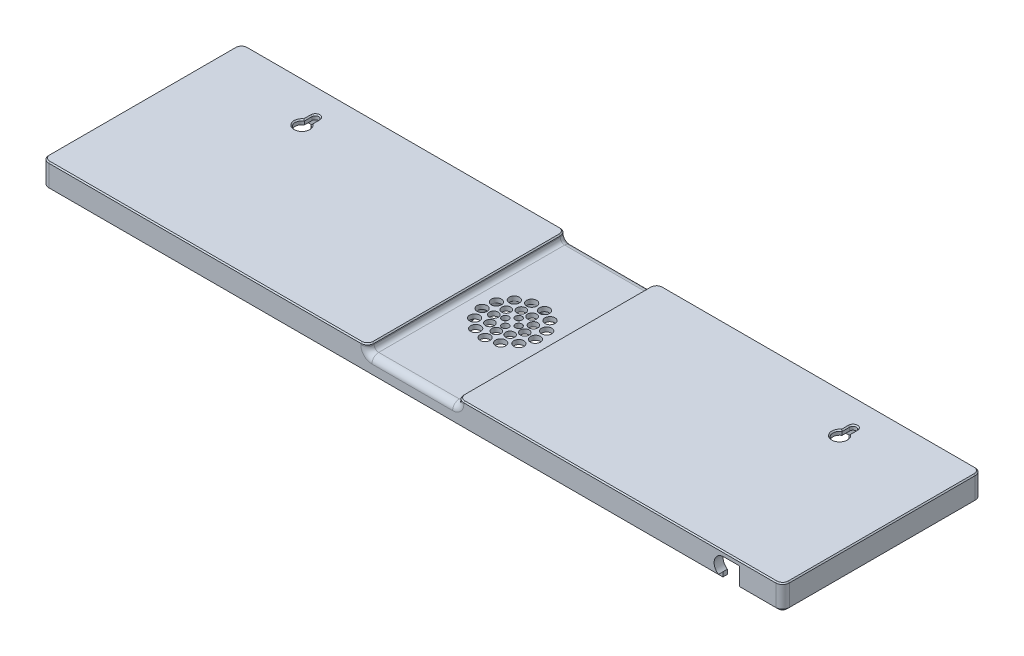
from build123d import *

# Parameters (mm, degrees)
SKETCH1_W           = 326.5
SKETCH1_H           = 85
SKETCH1_W_2         = 322.5
SKETCH1_H_2         = 81
BOSS_EXTRUDE1_DEPTH = 10
SKETCH2_W           = 330.5
SKETCH2_H           = 89
SKETCH2_W_2         = 322.5
SKETCH2_H_2         = 81
BOSS_EXTRUDE2_DEPTH = 8
SKETCH3_W           = 330.5
SKETCH3_H           = 89
BOSS_EXTRUDE3_DEPTH = 2
FILLET1_R           = 3
FILLET2_R           = 2
FILLET3_R           = 3
CHAMFER1_SIZE       = 0.5
CUT_EXTRUDE1_DEPTH  = 172.557024047
CHAMFER2_SIZE       = 0.5
SKETCH7_W           = 40
SKETCH7_H           = 6.166023439
CUT_EXTRUDE3_DEPTH  = 189.075948755
BOSS_EXTRUDE4_REACH = 190.076
FILLET4_R           = 2
CHAMFER3_SIZE       = 0.5
FILLET5_R           = 3
FILLET6_R           = 2
SKETCH9_R           = 16.25
SKETCH9_R_2         = 14.25
BOSS_EXTRUDE5_DEPTH = 3
SKETCH10_R          = 1.5
SKETCH10_R_2        = 2
SKETCH10_R_3        = 2.25
CUT_EXTRUDE4_DEPTH  = 172.279924393
CHAMFER4_SIZE       = 0.5
SKETCH12_W          = 30.6
SKETCH12_H          = 39
SKETCH12_W_2        = 26.6
SKETCH12_H_2        = 35
BOSS_EXTRUDE6_DEPTH = 6
SKETCH13_W          = 30.6
SKETCH13_H          = 4
BOSS_EXTRUDE7_DEPTH = 2.7
SKETCH14_W          = 3.373769955
SKETCH14_H          = 15.899358316
SKETCH14_W_2        = 15.312861043
SKETCH14_H_2        = 6.106571476
SKETCH14_W_3        = 6.70369678
SKETCH14_H_3        = 18.082973575
CUT_EXTRUDE5_DEPTH  = 6
FILLET7_R           = 2
CUT_EXTRUDE6_DEPTH  = 12.7
CUT_EXTRUDE7_DEPTH  = 12.7
CUT_EXTRUDE8_DEPTH  = 12.7
SKETCH19_W          = 25
SKETCH19_H          = 25.3
SKETCH19_W_2        = 21
SKETCH19_H_2        = 21.3
BOSS_EXTRUDE8_DEPTH = 6
SKETCH20_W          = 17
SKETCH20_H          = 11.292116592
CUT_EXTRUDE9_DEPTH  = 6
FILLET8_R           = 2
FILLET9_R           = 2
FILLET10_R          = 1


# Some blends are built 0.0001 mm under size
with BuildPart() as part:
    # Sketch1 → Boss-Extrude1 (new body)
    with BuildSketch(Plane(origin=(0, 0, 0), x_dir=(1, 0, 0), z_dir=(0, 1, 0))):
        Rectangle(SKETCH1_W, SKETCH1_H)
        Rectangle(SKETCH1_W_2, SKETCH1_H_2, mode=Mode.SUBTRACT)
    extrude(amount=BOSS_EXTRUDE1_DEPTH)

    # Sketch2 → Boss-Extrude2 (add)
    with BuildSketch(Plane(origin=(0, 10, 0), x_dir=(1, 0, 0), z_dir=(0, 1, 0))):
        Rectangle(SKETCH2_W, SKETCH2_H)
        Rectangle(SKETCH2_W_2, SKETCH2_H_2, mode=Mode.SUBTRACT)
    extrude(amount=-BOSS_EXTRUDE2_DEPTH)

    # Sketch3 → Boss-Extrude3 (add)
    with BuildSketch(Plane(origin=(0, 10, 0), x_dir=(1, 0, 0), z_dir=(0, 1, 0))):
        Rectangle(SKETCH3_W, SKETCH3_H)
    extrude(amount=BOSS_EXTRUDE3_DEPTH)

    # Fillet1
    fillet1_edges = [part.edges().sort_by_distance(p)[0] for p in [
        (161.25, 5, 40.5),
        (161.25, 5, -40.5),
        (-161.25, 5, -40.5),
        (-161.25, 5, 40.5),
    ]]
    fillet(fillet1_edges, radius=FILLET1_R)

    # Fillet2
    fillet2_edges = [part.edges().sort_by_distance(p)[0] for p in [
        (163.25, 1, 42.5),
        (-163.25, 1, 42.5),
        (-163.25, 1, -42.5),
        (163.25, 1, -42.5),
    ]]
    fillet(fillet2_edges, radius=FILLET2_R)

    # Fillet3
    fillet3_edges = [part.edges().sort_by_distance(p)[0] for p in [
        (165.25, 7, -44.5),
        (165.25, 7, 44.5),
        (-165.25, 7, 44.5),
        (-165.25, 7, -44.5),
    ]]
    fillet(fillet3_edges, radius=FILLET3_R)

    # Chamfer1
    chamfer1_edges = [part.edges().sort_by_distance(p)[0] for p in [
        (165.25, 12, 0),
        (-165.25, 12, 0),
        (0, 12, 44.5),
        (0, 12, -44.5),
        (-164.371320344, 12, -43.621320344),
        (-164.371320344, 12, 43.621320344),
        (164.371320344, 12, 43.621320344),
        (164.371320344, 12, -43.621320344),
    ]]
    chamfer(chamfer1_edges, length=CHAMFER1_SIZE)

    # Sketch4 → Cut-Extrude1 (cut, through all)
    with BuildSketch(Plane(origin=(0, 12, 0), x_dir=(1, 0, 0), z_dir=(0, 1, 0))):
        with BuildLine():
            Line((-121.5, 32.222687085), (-121.5, 28.820763297))
            ThreePointArc((-121.5, 28.820763297), (-120, 23.222687085), (-118.5, 28.820763297))
            Line((-118.5, 28.820763297), (-118.5, 32.222687085))
            ThreePointArc((-118.5, 32.222687085), (-120, 33.722687085), (-121.5, 32.222687085))
        make_face()
        with BuildLine():
            Line((118.5, 32.222687085), (118.5, 28.820763297))
            ThreePointArc((118.5, 28.820763297), (120, 23.222687085), (121.5, 28.820763297))
            Line((121.5, 28.820763297), (121.5, 32.222687085))
            ThreePointArc((121.5, 32.222687085), (120, 33.722687085), (118.5, 32.222687085))
        make_face()
    extrude(amount=-CUT_EXTRUDE1_DEPTH, mode=Mode.SUBTRACT)

    # Chamfer2
    chamfer2_edges = [part.edges().sort_by_distance(p)[0] for p in [
        (-120, 12, -33.722687085),
        (-121.5, 12, -30.521725191),
        (-120, 12, -23.222687085),
        (-118.5, 12, -30.521725191),
        (120, 12, -33.722687085),
        (118.5, 12, -30.521725191),
        (120, 12, -23.222687085),
        (121.5, 12, -30.521725191),
    ]]
    chamfer(chamfer2_edges, length=CHAMFER2_SIZE)

    # Sketch7 → Cut-Extrude3 (cut, through all)
    with BuildSketch(Plane(origin=(0, 0, -44.5), x_dir=(-1, 0, 0), z_dir=(0, 0, -1))):
        with Locations((0, 12.083011719)):
            Rectangle(SKETCH7_W, SKETCH7_H)
    extrude(amount=-CUT_EXTRUDE3_DEPTH, mode=Mode.SUBTRACT)

    # Boss-Extrude4: up to this face of the body (flat: up to its plane)
    boss_extrude4_end = Plane(part.part.faces().sort_by_distance((0, 6.63265862, 44.5))[0])
    # Sketch8 → Boss-Extrude4 (add, up to the picked face)
    with BuildSketch(Plane(origin=(0, 0, -44.5), x_dir=(-1, 0, 0), z_dir=(0, 0, -1)), mode=Mode.PRIVATE) as boss_extrude4_sk1:
        Polygon((-20, 12), (-20, 9), (20, 9), (20, 12), (22, 12), (22, 7), (-22, 7), (-22, 12), align=None)
    boss_extrude4_tool1 = split(extrude(boss_extrude4_sk1.sketch, amount=-BOSS_EXTRUDE4_REACH, mode=Mode.PRIVATE), bisect_by=boss_extrude4_end, keep=Keep.BOTH, mode=Mode.PRIVATE)
    add(boss_extrude4_tool1.solids().sort_by(Axis((0, 8.3, -44.5), (0, 0, 1)))[0])

    # Fillet4
    fillet4_edges = [part.edges().sort_by_distance(p)[0] for p in [
        (-20, 9, 0),
        (20, 9, 0),
    ]]
    fillet(fillet4_edges, radius=FILLET4_R)

    # Chamfer3
    # the kernel refuses this chamfer: 0.5 mm, written as the material it takes off along each edge
    with BuildSketch(Plane(origin=(22, 10.214158506, 44.5), x_dir=(-0.999621916911297, -2.130822274703722e-15, 0.027495876610582105), z_dir=(0, 1, 0))) as chamfer3_piece_1_section:
        Polygon((CHAMFER3_SIZE * 0.999621916911, -CHAMFER3_SIZE * 0.0274958766106), (-CHAMFER3_SIZE * 0.0274958766106, -CHAMFER3_SIZE * 0.999621916911), (0, 0), align=None)
    chamfer3_piece_1 = extrude(amount=3.071682988, mode=Mode.PRIVATE)
    chamfer3_piece_1 = split(chamfer3_piece_1, bisect_by=Plane(origin=(21.8125, 11.71875, 44.28125), z_dir=(0, 0.7071067811865476, 0.7071067811865476)), keep=Keep.TOP, mode=Mode.PRIVATE)
    add(chamfer3_piece_1, mode=Mode.SUBTRACT)
    with BuildSketch(Plane(origin=(-22, 12, -45.785841494), x_dir=(0.9996219169112968, 0.02749587661058555, 0), z_dir=(0, 0, 1))) as chamfer3_piece_2_section:
        Polygon((CHAMFER3_SIZE * 0.999621916911, -CHAMFER3_SIZE * 0.0274958766106), (-CHAMFER3_SIZE * 0.0274958766106, -CHAMFER3_SIZE * 0.999621916911), (0, 0), align=None)
    chamfer3_piece_2 = extrude(amount=3.071682988, mode=Mode.PRIVATE)
    chamfer3_piece_2 = split(chamfer3_piece_2, bisect_by=Plane(origin=(-21.8125, 11.78125, -44.21875), z_dir=(0, 0.7071067811865476, -0.7071067811865476)), keep=Keep.TOP, mode=Mode.PRIVATE)
    add(chamfer3_piece_2, mode=Mode.SUBTRACT)
    with BuildSketch(Plane(origin=(22, 12, -45.785841494), x_dir=(-0.9996219169112968, 0.02749587661058555, 0), z_dir=(0, 0, 1))) as chamfer3_piece_3_section:
        Polygon((CHAMFER3_SIZE * 0.999621916911, CHAMFER3_SIZE * 0.0274958766106), (-CHAMFER3_SIZE * 0.0274958766106, CHAMFER3_SIZE * 0.999621916911), (0, 0), align=None)
    chamfer3_piece_3 = extrude(amount=3.071682988, mode=Mode.PRIVATE)
    chamfer3_piece_3 = split(chamfer3_piece_3, bisect_by=Plane(origin=(21.8125, 11.78125, -44.21875), z_dir=(0, 0.7071067811865476, -0.7071067811865476)), keep=Keep.TOP, mode=Mode.PRIVATE)
    add(chamfer3_piece_3, mode=Mode.SUBTRACT)
    with BuildSketch(Plane(origin=(23.285841494, 12, -44.5), x_dir=(0, -0.999621916911297, -0.0274958766105822), z_dir=(-1, 0, 0)), Plane(origin=(-18.714158506, 12, -44.5), x_dir=(0, -0.999621916911297, -0.0274958766105822), z_dir=(-1, 0, 0)), Plane(origin=(-18.714158506, 12, 44.5), x_dir=(0, 0.02749587661058574, -0.9996219169112968), z_dir=(-1, 0, 0))) as chamfer3_piece_4:
        Polygon((CHAMFER3_SIZE * 0.999621916911, CHAMFER3_SIZE * 0.0274958766106), (-CHAMFER3_SIZE * 0.0274958766106, CHAMFER3_SIZE * 0.999621916911), (0, 0), align=None)
    extrude(amount=4.571682988, mode=Mode.SUBTRACT)
    with BuildSketch(Plane(origin=(22, 10.214158506, -44.5), x_dir=(-0.999621916911297, -2.130822274703722e-15, -0.027495876610582105), z_dir=(0, 1, 0))) as chamfer3_piece_5_section:
        Polygon((CHAMFER3_SIZE * 0.999621916911, CHAMFER3_SIZE * 0.0274958766106), (-CHAMFER3_SIZE * 0.0274958766106, CHAMFER3_SIZE * 0.999621916911), (0, 0), align=None)
    chamfer3_piece_5 = extrude(amount=3.071682988, mode=Mode.PRIVATE)
    chamfer3_piece_5 = split(chamfer3_piece_5, bisect_by=Plane(origin=(21.8125, 11.71875, -44.28125), z_dir=(0, 0.7071067811865476, -0.7071067811865476)), keep=Keep.TOP, mode=Mode.PRIVATE)
    add(chamfer3_piece_5, mode=Mode.SUBTRACT)
    with BuildSketch(Plane(origin=(-22, 13.285841494, -44.5), x_dir=(0.999621916911297, 0, -0.027495876610582105), z_dir=(0, -1, 0))) as chamfer3_piece_6_section:
        Polygon((CHAMFER3_SIZE * 0.999621916911, CHAMFER3_SIZE * 0.0274958766106), (-CHAMFER3_SIZE * 0.0274958766106, CHAMFER3_SIZE * 0.999621916911), (0, 0), align=None)
    chamfer3_piece_6 = extrude(amount=3.071682988, mode=Mode.PRIVATE)
    chamfer3_piece_6 = split(chamfer3_piece_6, bisect_by=Plane(origin=(-21.8125, 11.71875, -44.28125), z_dir=(0, 0.7071067811865476, -0.7071067811865476)), keep=Keep.TOP, mode=Mode.PRIVATE)
    add(chamfer3_piece_6, mode=Mode.SUBTRACT)
    with BuildSketch(Plane(origin=(-22, 12, 42.714158506), x_dir=(0.9996219169112968, 0.02749587661058555, 0), z_dir=(0, 0, 1))) as chamfer3_piece_7_section:
        Polygon((CHAMFER3_SIZE * 0.999621916911, -CHAMFER3_SIZE * 0.0274958766106), (-CHAMFER3_SIZE * 0.0274958766106, -CHAMFER3_SIZE * 0.999621916911), (0, 0), align=None)
    chamfer3_piece_7 = extrude(amount=3.071682988, mode=Mode.PRIVATE)
    chamfer3_piece_7 = split(chamfer3_piece_7, bisect_by=Plane(origin=(-21.8125, 11.78125, 44.21875), z_dir=(0, 0.7071067811865476, 0.7071067811865476)), keep=Keep.TOP, mode=Mode.PRIVATE)
    add(chamfer3_piece_7, mode=Mode.SUBTRACT)
    with BuildSketch(Plane(origin=(-22, 13.285841494, 44.5), x_dir=(0.999621916911297, 0, 0.027495876610582105), z_dir=(0, -1, 0))) as chamfer3_piece_8_section:
        Polygon((CHAMFER3_SIZE * 0.999621916911, -CHAMFER3_SIZE * 0.0274958766106), (-CHAMFER3_SIZE * 0.0274958766106, -CHAMFER3_SIZE * 0.999621916911), (0, 0), align=None)
    chamfer3_piece_8 = extrude(amount=3.071682988, mode=Mode.PRIVATE)
    chamfer3_piece_8 = split(chamfer3_piece_8, bisect_by=Plane(origin=(-21.8125, 11.71875, 44.28125), z_dir=(0, 0.7071067811865476, 0.7071067811865476)), keep=Keep.TOP, mode=Mode.PRIVATE)
    add(chamfer3_piece_8, mode=Mode.SUBTRACT)
    with BuildSketch(Plane(origin=(22, 12, 42.714158506), x_dir=(-0.9996219169112968, 0.02749587661058555, 0), z_dir=(0, 0, 1))) as chamfer3_piece_9_section:
        Polygon((CHAMFER3_SIZE * 0.999621916911, CHAMFER3_SIZE * 0.0274958766106), (-CHAMFER3_SIZE * 0.0274958766106, CHAMFER3_SIZE * 0.999621916911), (0, 0), align=None)
    chamfer3_piece_9 = extrude(amount=3.071682988, mode=Mode.PRIVATE)
    chamfer3_piece_9 = split(chamfer3_piece_9, bisect_by=Plane(origin=(21.8125, 11.78125, 44.21875), z_dir=(0, 0.7071067811865476, 0.7071067811865476)), keep=Keep.TOP, mode=Mode.PRIVATE)
    add(chamfer3_piece_9, mode=Mode.SUBTRACT)
    with BuildSketch(Plane(origin=(23.285841494, 12, 44.5), x_dir=(0, -0.999621916911297, 0.0274958766105822), z_dir=(-1, 0, 0))) as chamfer3_piece_10:
        Polygon((CHAMFER3_SIZE * 0.999621916911, -CHAMFER3_SIZE * 0.0274958766106), (-CHAMFER3_SIZE * 0.0274958766106, -CHAMFER3_SIZE * 0.999621916911), (0, 0), align=None)
    extrude(amount=4.571682988, mode=Mode.SUBTRACT)

    # Fillet5
    fillet5_edges = [part.edges().sort_by_distance(p)[0] for p in [
        (20, 11.25, 44.5),
        (19.414213562, 9.585786438, 44.5),
        (-20, 11.25, 44.5),
        (-19.414213562, 9.585786438, 44.5),
        (20, 11.25, -44.5),
        (19.414213562, 9.585786438, -44.5),
        (-20, 11.25, -44.5),
        (-19.414213562, 9.585786438, -44.5),
        (0, 9, -44.5),
        (0, 9, 44.5),
    ]]
    fillet(fillet5_edges, radius=FILLET5_R)

    # Fillet6
    fillet6_edges = [part.edges().sort_by_distance(p)[0] for p in [
        (22, 10, 0),
        (-22, 10, 0),
    ]]
    fillet(fillet6_edges, radius=FILLET6_R)

    # Sketch9 → Boss-Extrude5 (add)
    with BuildSketch(Plane.XZ.offset(-7)):
        Circle(SKETCH9_R)
        Circle(SKETCH9_R_2, mode=Mode.SUBTRACT)
    extrude(amount=BOSS_EXTRUDE5_DEPTH)

    # Sketch10 → Cut-Extrude4 (cut, through all)
    with BuildSketch(Plane.XZ.offset(-7)):
        with Locations((0, 3)):
            Circle(SKETCH10_R)
        with Locations((0, 7)):
            Circle(SKETCH10_R_2)
        with Locations((0, 12)):
            Circle(SKETCH10_R_3)
        with Locations((4.499513268, 5.362311102)):
            Circle(SKETCH10_R_2)
        with Locations((6.893654271, 1.215537244)):
            Circle(SKETCH10_R_2)
        with Locations((6.062177826, -3.5)):
            Circle(SKETCH10_R_2)
        with Locations((2.394141003, -6.577848346)):
            Circle(SKETCH10_R_2)
        with Locations((-2.394141003, -6.577848346)):
            Circle(SKETCH10_R_2)
        with Locations((-6.062177826, -3.5)):
            Circle(SKETCH10_R_2)
        with Locations((-6.893654271, 1.215537244)):
            Circle(SKETCH10_R_2)
        with Locations((-4.499513268, 5.362311102)):
            Circle(SKETCH10_R_2)
        with Locations((3, 0)):
            Circle(SKETCH10_R)
        with Locations((0, -3)):
            Circle(SKETCH10_R)
        with Locations((-3, 0)):
            Circle(SKETCH10_R)
        with Locations((5.576678065, 10.625472308)):
            Circle(SKETCH10_R_3)
        with Locations((9.875806391, 6.816776961)):
            Circle(SKETCH10_R_3)
        with Locations((11.912506489, 1.446440163)):
            Circle(SKETCH10_R_3)
        with Locations((11.220194912, -4.255258645)):
            Circle(SKETCH10_R_3)
        with Locations((7.957471899, -8.982128978)):
            Circle(SKETCH10_R_3)
        with Locations((2.871787971, -11.651301809)):
            Circle(SKETCH10_R_3)
        with Locations((-2.871787971, -11.651301809)):
            Circle(SKETCH10_R_3)
        with Locations((-7.957471899, -8.982128978)):
            Circle(SKETCH10_R_3)
        with Locations((-11.220194912, -4.255258645)):
            Circle(SKETCH10_R_3)
        with Locations((-11.912506489, 1.446440163)):
            Circle(SKETCH10_R_3)
        with Locations((-9.875806391, 6.816776961)):
            Circle(SKETCH10_R_3)
        with Locations((-5.576678065, 10.625472308)):
            Circle(SKETCH10_R_3)
    extrude(amount=-CUT_EXTRUDE4_DEPTH, mode=Mode.SUBTRACT)

    # Chamfer4
    chamfer4_edges = [part.edges().sort_by_distance(p)[0] for p in [
        (20, 12, 0),
        (20.356617963, 12, -42.918637165),
        (20.356617963, 12, 42.918637165),
        (-20, 12, 0),
        (-20.356617963, 12, -42.918637165),
        (-20.356617963, 12, 42.918637165),
    ]]
    chamfer(chamfer4_edges, length=CHAMFER4_SIZE - 0.0001)  # a hair under: the kernel refuses the full size

    # Sketch12 → Boss-Extrude6 (add)
    with BuildSketch(Plane.XZ.offset(-10)):
        with Locations((142.95, 3)):
            Rectangle(SKETCH12_W, SKETCH12_H)
        with Locations((142.95, 3)):
            Rectangle(SKETCH12_W_2, SKETCH12_H_2, mode=Mode.SUBTRACT)
    extrude(amount=BOSS_EXTRUDE6_DEPTH)

    # Sketch13 → Boss-Extrude7 (add)
    with BuildSketch(Plane.XZ.offset(-10)):
        with Locations((142.95, -14.5)):
            Rectangle(SKETCH13_W, SKETCH13_H)
    extrude(amount=BOSS_EXTRUDE7_DEPTH)

    # Sketch14 → Cut-Extrude5 (cut)
    with BuildSketch(Plane.XZ.offset(-4)):
        with Locations((157.936884978, 16.074384573)):
            Rectangle(SKETCH14_W, SKETCH14_H)
        with Locations((143.337214565, 21.464137582)):
            Rectangle(SKETCH14_W_2, SKETCH14_H_2)
        with Locations((129.195604024, 2.873540073)):
            Rectangle(SKETCH14_W_3, SKETCH14_H_3)
    extrude(amount=-CUT_EXTRUDE5_DEPTH, mode=Mode.SUBTRACT)

    # Fillet7
    fillet7_edges = [part.edges().sort_by_distance(p)[0] for p in [
        (150.993645086, 7, 20.5),
        (135.680784043, 7, 20.5),
        (129.65, 7, 11.91502686),
        (156.25, 7, 8.124705415),
        (129.65, 7, -6.167946715),
    ]]
    fillet(fillet7_edges, radius=FILLET7_R - 0.0001)  # a hair under: the kernel refuses the full size

    # Sketch15 → Cut-Extrude6 (cut)
    with BuildSketch(Plane.XY.offset(-40.5)):
        with BuildLine():
            Line((142.732418969, 8.83308219), (145.68707631, 8.83308219))
            ThreePointArc((145.68707631, 8.83308219), (146.85974764, 6.63308219), (145.68707631, 4.43308219))
            Line((145.68707631, 4.43308219), (142.732418969, 4.43308219))
            ThreePointArc((142.732418969, 4.43308219), (141.55974764, 6.63308219), (142.732418969, 8.83308219))
        make_face()
    extrude(amount=-CUT_EXTRUDE6_DEPTH, mode=Mode.SUBTRACT)

    # Sketch16 → Cut-Extrude7 (cut)
    with BuildSketch(Plane(origin=(0, 0, 40.5), x_dir=(-1, 0, 0), z_dir=(0, 0, -1))):
        with BuildLine():
            Line((-146.114315764, 9.98869973), (-139.089315764, 9.98869973))
            ThreePointArc((-139.089315764, 9.98869973), (-134.714315764, 5.61369973), (-139.089315764, 1.23869973))
            Line((-139.089315764, 1.23869973), (-146.114315764, 1.23869973))
            Line((-146.114315764, 1.23869973), (-146.114315764, 5.61369973))
            Line((-146.114315764, 5.61369973), (-146.114315764, 9.98869973))
        make_face()
    extrude(amount=-CUT_EXTRUDE7_DEPTH, mode=Mode.SUBTRACT)

    # Sketch17 → Cut-Extrude8 (cut)
    with BuildSketch(Plane.XY.offset(44.5)):
        Polygon((136.623185341, 2), (146.114315764, 4.571516723), (146.114315764, -5.033546584), (136.623185341, -4.403350122), align=None)
    extrude(amount=-CUT_EXTRUDE8_DEPTH, mode=Mode.SUBTRACT)

    # Sketch19 → Boss-Extrude8 (add)
    with BuildSketch(Plane.XZ.offset(-10)):
        with Locations((48.241330984, -14.734055582)):
            Rectangle(SKETCH19_W, SKETCH19_H)
        with Locations((48.241330984, -14.734055582)):
            Rectangle(SKETCH19_W_2, SKETCH19_H_2, mode=Mode.SUBTRACT)
    extrude(amount=BOSS_EXTRUDE8_DEPTH)

    # Sketch20 → Cut-Extrude9 (cut)
    with BuildSketch(Plane.XZ.offset(-4)):
        with Locations((48.241330984, -27.384055582)):
            Rectangle(SKETCH20_W, SKETCH20_H)
    extrude(amount=-CUT_EXTRUDE9_DEPTH, mode=Mode.SUBTRACT)

    # Fillet8
    fillet8_edges = [part.edges().sort_by_distance(p)[0] for p in [
        (39.741330984, 7, -25.384055582),
        (56.741330984, 7, -25.384055582),
    ]]
    fillet(fillet8_edges, radius=FILLET8_R - 0.0001)  # a hair under: the kernel refuses the full size

    # Fillet9
    fillet9_edges = [part.edges().sort_by_distance(p)[0] for p in [
        (60.741330984, 7, -2.084055582),
        (35.741330984, 7, -2.084055582),
        (158.25, 7, -16.5),
        (127.65, 7, 22.5),
        (127.65, 7, -16.5),
    ]]
    fillet(fillet9_edges, radius=FILLET9_R)

    # Fillet10
    fillet10_edges = [part.edges().sort_by_distance(p)[0] for p in [
        (-16.25, 4, 0),
        (-16.25, 7, 0),
        (-14.25, 4, 0),
    ]]
    fillet(fillet10_edges, radius=FILLET10_R - 0.0001)  # a hair under: the kernel refuses the full size


solid = part.part
